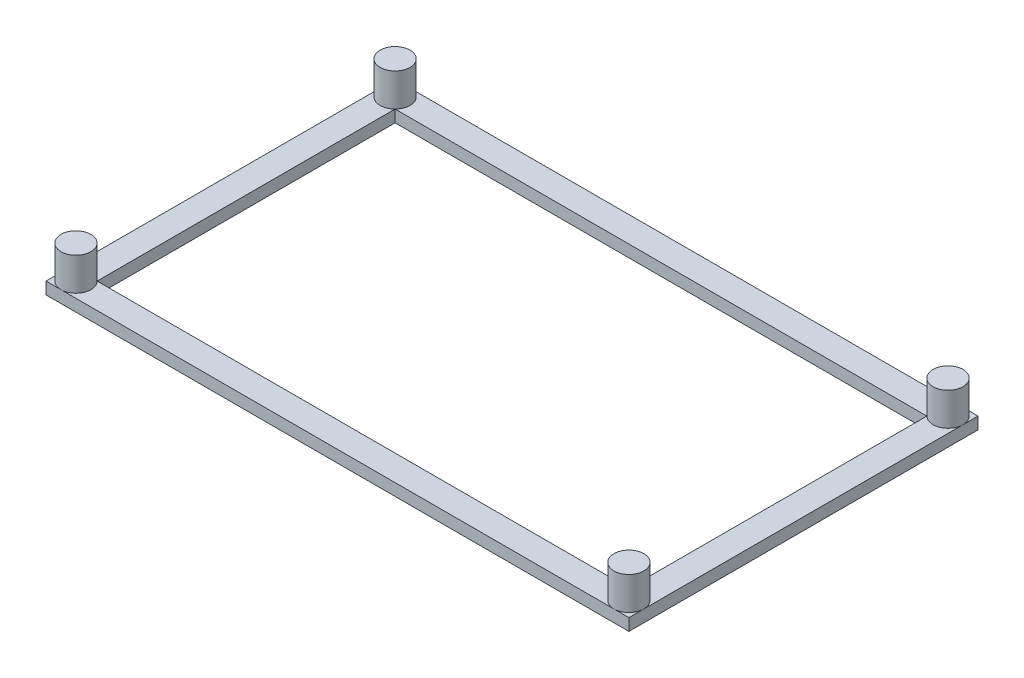
from build123d import *

# Parameters (mm, degrees)
SKETCH4_R             = 2.5
BOSS_EXTRUDE4_DEPTH   = 7.5
BOSS_EXTRUDE4_2_DEPTH = 7.5
BOSS_EXTRUDE4_3_DEPTH = 7.5
BOSS_EXTRUDE4_4_DEPTH = 7.5
SKETCH5_W             = 97.316999936
SKETCH5_H             = 58.277
SKETCH5_W_2           = 88.78146603
SKETCH5_H_2           = 49.741466094
BOSS_EXTRUDE5_DEPTH   = 2


with BuildPart() as part:
    # Sketch4 → Boss-Extrude4 (new body)
    with BuildSketch(Plane(origin=(0, 0, 0), x_dir=(1, 0, 0), z_dir=(0, 1, 0))):
        with Locations((0.341500064, 62.6915)):
            Circle(SKETCH4_R)
    extrude(amount=BOSS_EXTRUDE4_DEPTH)



with BuildPart() as body_2:
    # Sketch4 → Boss-Extrude4 2 (new body)
    with BuildSketch(Plane(origin=(0, 0, 0), x_dir=(1, 0, 0), z_dir=(0, 1, 0))):
        with Locations((92.6585, 62.6915)):
            Circle(SKETCH4_R)
    extrude(amount=BOSS_EXTRUDE4_2_DEPTH)


with BuildPart() as body_3:
    # Sketch4 → Boss-Extrude4 3 (new body)
    with BuildSketch(Plane(origin=(0, 0, 0), x_dir=(1, 0, 0), z_dir=(0, 1, 0))):
        with Locations((92.6585, 115.9685)):
            Circle(SKETCH4_R)
    extrude(amount=BOSS_EXTRUDE4_3_DEPTH)


with BuildPart() as body_4:
    # Sketch4 → Boss-Extrude4 4 (new body)
    with BuildSketch(Plane(origin=(0, 0, 0), x_dir=(1, 0, 0), z_dir=(0, 1, 0))):
        with Locations((0.341500064, 115.9685)):
            Circle(SKETCH4_R)
    extrude(amount=BOSS_EXTRUDE4_4_DEPTH)


with BuildPart() as part_1:
    add(part.part)

    add(body_2.part)  # Boss-Extrude5 merges body 2

    add(body_3.part)  # Boss-Extrude5 merges body 3

    add(body_4.part)  # Boss-Extrude5 merges body 4
    # Sketch5 → Boss-Extrude5 (add)
    with BuildSketch(Plane.XZ):
        with Locations((46.500000032, -89.33)):
            Rectangle(SKETCH5_W, SKETCH5_H)
        with Locations((46.500000032, -89.33)):
            Rectangle(SKETCH5_W_2, SKETCH5_H_2, mode=Mode.SUBTRACT)
    extrude(amount=-BOSS_EXTRUDE5_DEPTH)


solid = part_1.part
